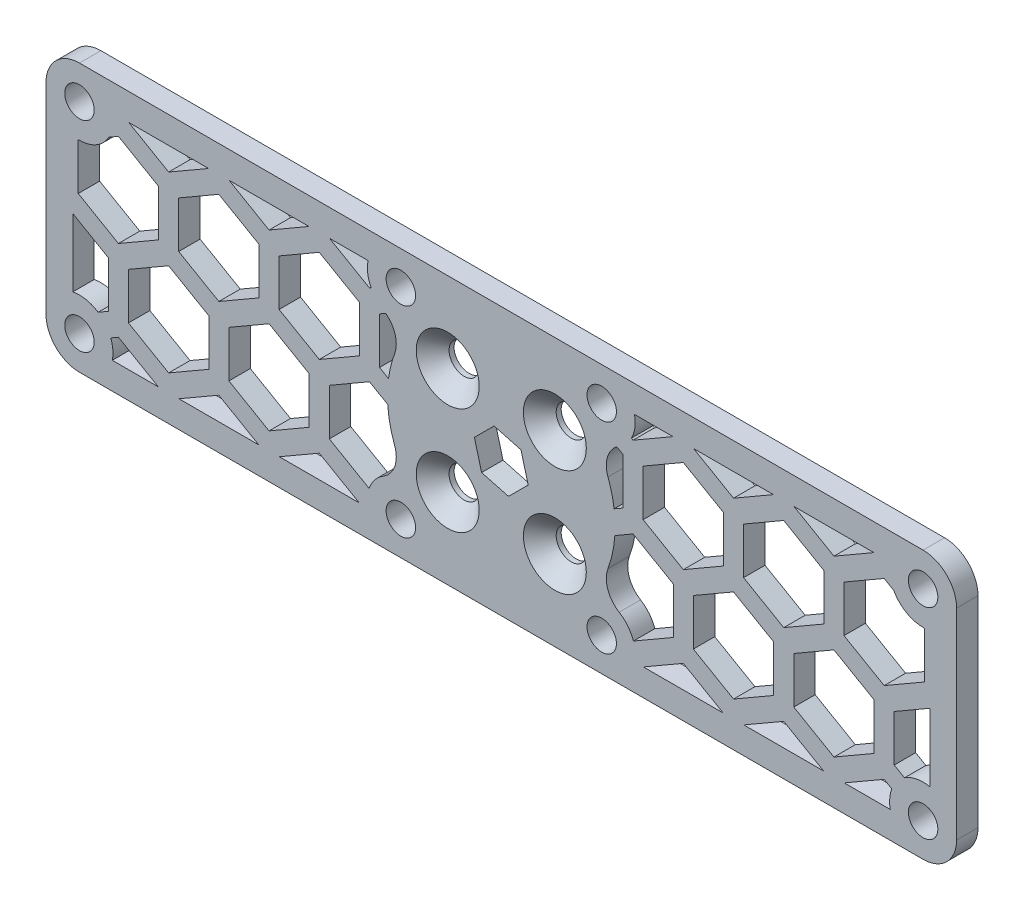
from build123d import *

# Parameters (mm, degrees)
STOCK_BODY_PITCH_GIMBAL_BOX_MASTER_1_START   = -122.57
STOCK_BODY_PITCH_GIMBAL_BOX_MASTER_1_OUT_W   = 136
STOCK_BODY_PITCH_GIMBAL_BOX_MASTER_1_OUT_H   = 40
STOCK_BODY_PITCH_GIMBAL_BOX_MASTER_1_OUT_R   = 2.2
STOCK_BODY_PITCH_GIMBAL_BOX_MASTER_1_DEPTH   = 3.2
CUT_EXTRUDE1_DEPTH                           = 71.952378396
FILLET1_R                                    = 4
BOSS_EXTRUDE1_DEPTH                          = 3.2
CUT_EXTRUDE2_DEPTH                           = 71.952378524
FILL_START                                   = -122.57
FILL_PATTERN1_DEPTH                          = 3.2
FILLET2_R                                    = 5
CSK_FOR_M4_COUNTERSUNK_FLAT_HEAD_SCR_2_COUNT = 2
CSK_FOR_M4_COUNTERSUNK_FLAT_HEAD_SCR_2_PITCH = 16
CSK_FOR_M4_COUNTERSUNK_FLAT_HEAD_SCR_3_COUNT = 2
CSK_FOR_M4_COUNTERSUNK_FLAT_HEAD_SCR_3_PITCH = 22.627416998
CSK_FOR_M4_COUNTERSUNK_FLAT_HEAD_SCR_4_COUNT = 2
CSK_FOR_M4_COUNTERSUNK_FLAT_HEAD_SCR_4_PITCH = 16


# Read off the part's stored shape, not the designer's step: Stock-body_pitch_gimbal_box_master-1, Fill Pattern1
with BuildPart() as part:
    # Stock-body_pitch_gimbal_box_master-1 out → Stock-body_pitch_gimbal_box_master-1 (new body)
    with BuildSketch(Plane.XY.offset(STOCK_BODY_PITCH_GIMBAL_BOX_MASTER_1_START)):
        Rectangle(STOCK_BODY_PITCH_GIMBAL_BOX_MASTER_1_OUT_W, STOCK_BODY_PITCH_GIMBAL_BOX_MASTER_1_OUT_H)
        with Locations((-63, -15)):
            Circle(STOCK_BODY_PITCH_GIMBAL_BOX_MASTER_1_OUT_R, mode=Mode.SUBTRACT)
        with Locations((-15, -15)):
            Circle(STOCK_BODY_PITCH_GIMBAL_BOX_MASTER_1_OUT_R, mode=Mode.SUBTRACT)
        with Locations((-8, -8)):
            Circle(STOCK_BODY_PITCH_GIMBAL_BOX_MASTER_1_OUT_R, mode=Mode.SUBTRACT)
        with Locations((15, -15)):
            Circle(STOCK_BODY_PITCH_GIMBAL_BOX_MASTER_1_OUT_R, mode=Mode.SUBTRACT)
        with Locations((63, -15)):
            Circle(STOCK_BODY_PITCH_GIMBAL_BOX_MASTER_1_OUT_R, mode=Mode.SUBTRACT)
        with Locations((8, -8)):
            Circle(STOCK_BODY_PITCH_GIMBAL_BOX_MASTER_1_OUT_R, mode=Mode.SUBTRACT)
        with Locations((-8, 8)):
            Circle(STOCK_BODY_PITCH_GIMBAL_BOX_MASTER_1_OUT_R, mode=Mode.SUBTRACT)
        with Locations((-63, 15)):
            Circle(STOCK_BODY_PITCH_GIMBAL_BOX_MASTER_1_OUT_R, mode=Mode.SUBTRACT)
        with Locations((-15, 15)):
            Circle(STOCK_BODY_PITCH_GIMBAL_BOX_MASTER_1_OUT_R, mode=Mode.SUBTRACT)
        Polygon((1.075890567, -4.015278258), (-2.939387691, -2.939387691), (-4.015278258, 1.075890567), (-1.075890567, 4.015278258), (2.939387691, 2.939387691), (4.015278258, -1.075890567), align=None, mode=Mode.SUBTRACT)
        with Locations((8, 8)):
            Circle(STOCK_BODY_PITCH_GIMBAL_BOX_MASTER_1_OUT_R, mode=Mode.SUBTRACT)
        with Locations((15, 15)):
            Circle(STOCK_BODY_PITCH_GIMBAL_BOX_MASTER_1_OUT_R, mode=Mode.SUBTRACT)
        with Locations((63, 15)):
            Circle(STOCK_BODY_PITCH_GIMBAL_BOX_MASTER_1_OUT_R, mode=Mode.SUBTRACT)
    extrude(amount=STOCK_BODY_PITCH_GIMBAL_BOX_MASTER_1_DEPTH)

    # Sketch1 → Cut-Extrude1 (cut, through all)
    with BuildSketch(Plane.XY.offset(-119.37)):
        with BuildLine():
            ThreePointArc((-58, 15), (-59.83772234, 11.127016654), (-64, 10.101020514))
            Line((-64, 10.101020514), (-64, -10.101020514))
            ThreePointArc((-64, -10.101020514), (-59.83772234, -11.127016654), (-58, -15))
            ThreePointArc((-58, -15), (-58.025319235, -15.50254481), (-58.101020514, -16))
            Line((-58.101020514, -16), (-19.898979486, -16))
            ThreePointArc((-19.898979486, -16), (-18.386844307, -11.321782274), (-13.6, -10.2))
            ThreePointArc((-13.6, -10.2), (-17, 0), (-13.6, 10.2))
            ThreePointArc((-13.6, 10.2), (-18.386844307, 11.321782274), (-19.898979486, 16))
            Line((-19.898979486, 16), (-58.101020514, 16))
            ThreePointArc((-58.101020514, 16), (-58.025319235, 15.50254481), (-58, 15))
        make_face()
        with BuildLine():
            Line((58.101020514, 16), (19.898979486, 16))
            ThreePointArc((19.898979486, 16), (19.974680765, 15.50254481), (20, 15))
            ThreePointArc((20, 15), (18, 11), (13.6, 10.2))
            ThreePointArc((13.6, 10.2), (16.127616067, 5.375872022), (17, 0))
            ThreePointArc((17, 0), (16.127616067, -5.375872022), (13.6, -10.2))
            ThreePointArc((13.6, -10.2), (18, -11), (20, -15))
            ThreePointArc((20, -15), (19.974680765, -15.50254481), (19.898979486, -16))
            Line((19.898979486, -16), (58.101020514, -16))
            ThreePointArc((58.101020514, -16), (59.464466094, -11.464466094), (64, -10.101020514))
            Line((64, -10.101020514), (64, 10.101020514))
            ThreePointArc((64, 10.101020514), (59.464466094, 11.464466094), (58.101020514, 16))
        make_face()
    extrude(amount=-CUT_EXTRUDE1_DEPTH, mode=Mode.SUBTRACT)

    # Fillet1
    fillet1_edges = [part.edges().sort_by_distance(p)[0] for p in [
        (-13.6, -10.2, -120.97),
        (-13.6, 10.2, -120.97),
        (13.6, -10.2, -120.97),
        (13.6, 10.2, -120.97),
    ]]
    fillet(fillet1_edges, radius=FILLET1_R)


with BuildPart() as body_2:
    # Sketch2 → Boss-Extrude1 (new body)
    with BuildSketch(Plane.XY.offset(-119.37)):
        with BuildLine():
            ThreePointArc((-58.101020514, 16), (-59.464466094, 11.464466094), (-64, 10.101020514))
            Line((-64, 10.101020514), (-64, -10.101020514))
            ThreePointArc((-64, -10.101020514), (-59.464466094, -11.464466094), (-58.101020514, -16))
            Line((-58.101020514, -16), (-19.898979486, -16))
            ThreePointArc((-19.898979486, -16), (-19.583627385, -13.002411456), (-17.602588021, -10.730745312))
            ThreePointArc((-17.602588021, -10.730745312), (-15.905395598, -8.625750803), (-15.935199688, -5.921943169))
            ThreePointArc((-15.935199688, -5.921943169), (-17, 0), (-15.935199688, 5.921943169))
            ThreePointArc((-15.935199688, 5.921943169), (-15.905395598, 8.625750803), (-17.602588021, 10.730745312))
            ThreePointArc((-17.602588021, 10.730745312), (-19.583627385, 13.002411456), (-19.898979486, 16))
            Line((-19.898979486, 16), (-58.101020514, 16))
        make_face()
    extrude(amount=-BOSS_EXTRUDE1_DEPTH)

    # Sketch3 → Cut-Extrude2 (cut, through all)
    with BuildSketch(Plane.XY.offset(-119.37)):
        Polygon((-21.184658438, 9.959292144), (-27.184658438, 13.423393759), (-33.184658438, 9.959292144), (-33.184658438, 3.031088913), (-27.184658438, -0.433012702), (-21.184658438, 3.031088913), align=None)
        Polygon((-13.684658438, -3.031088913), (-19.684658438, 0.433012702), (-25.684658438, -3.031088913), (-25.684658438, -9.959292144), (-19.684658438, -13.423393759), (-13.684658438, -9.959292144), align=None)
    extrude(amount=-CUT_EXTRUDE2_DEPTH, mode=Mode.SUBTRACT)

    # Fill Pattern1 outline → Fill Pattern1 (cut)
    with BuildSketch(Plane.XY.offset(FILL_START)):
        Polygon((-55.684658438, -9.959292144), (-49.684658438, -13.423393759), (-43.684658438, -9.959292144), (-43.684658438, -3.031088913), (-49.684658438, 0.433012702), (-55.684658438, -3.031088913), align=None)
        Polygon((-43.721845517, 16), (-55.64747136, 16), (-49.684658438, 12.557368355), align=None)
        Polygon((-27.184658438, -12.557368355), (-33.14747136, -16), (-21.221845517, -16), align=None)
        Polygon((-42.184658438, -12.557368355), (-48.14747136, -16), (-36.221845517, -16), align=None)
        with BuildLine():
            Line((-57.184658438, -12.557368355), (-58.328436124, -13.21772871))
            ThreePointArc((-58.328436124, -13.21772871), (-58.016619276, -14.592671438), (-58.101020514, -16))
            Line((-58.101020514, -16), (-51.221845517, -16))
            Line((-51.221845517, -16), (-57.184658438, -12.557368355))
        make_face()
        with BuildLine():
            Line((-58.684658438, -3.031088913), (-64, 0.037724968))
            Line((-64, 0.037724968), (-64, -10.101020514))
            ThreePointArc((-64, -10.101020514), (-62.034790063, -10.094047516), (-60.218689568, -10.844965429))
            Line((-60.218689568, -10.844965429), (-58.684658438, -9.959292144))
            Line((-58.684658438, -9.959292144), (-58.684658438, -3.031088913))
        make_face()
        with BuildLine():
            Line((-57.184658438, 13.423393759), (-58.614969913, 12.597603044))
            ThreePointArc((-58.614969913, 12.597603044), (-60.5, 10.669872981), (-63.11197825, 10.00125407))
            Line((-63.11197825, 10.00125407), (-63.184658438, 9.959292144))
            Line((-63.184658438, 9.959292144), (-63.184658438, 3.031088913))
            Line((-63.184658438, 3.031088913), (-57.184658438, -0.433012702))
            Line((-57.184658438, -0.433012702), (-51.184658438, 3.031088913))
            Line((-51.184658438, 3.031088913), (-51.184658438, 9.959292144))
            Line((-51.184658438, 9.959292144), (-57.184658438, 13.423393759))
        make_face()
        with BuildLine():
            ThreePointArc((-15.935199688, 5.921943169), (-15.842056464, 8.426381643), (-17.257347713, 10.494675241))
            Line((-17.257347713, 10.494675241), (-18.184658438, 9.959292144))
            Line((-18.184658438, 9.959292144), (-18.184658438, 3.031088913))
            Line((-18.184658438, 3.031088913), (-16.849105828, 2.260007254))
            ThreePointArc((-16.849105828, 2.260007254), (-16.494093358, 4.116416438), (-15.935199688, 5.921943169))
        make_face()
        with BuildLine():
            Line((-19.898979486, 16), (-25.64747136, 16))
            Line((-25.64747136, 16), (-19.684658438, 12.557368355))
            Line((-19.684658438, 12.557368355), (-19.439138295, 12.699119475))
            ThreePointArc((-19.439138295, 12.699119475), (-19.952177701, 14.31011884), (-19.898979486, 16))
        make_face()
        Polygon((-28.721845517, 16), (-40.64747136, 16), (-34.684658438, 12.557368355), align=None)
        Polygon((-48.184658438, 9.959292144), (-48.184658438, 3.031088913), (-42.184658438, -0.433012702), (-36.184658438, 3.031088913), (-36.184658438, 9.959292144), (-42.184658438, 13.423393759), align=None)
        Polygon((-34.684658438, -13.423393759), (-28.684658438, -9.959292144), (-28.684658438, -3.031088913), (-34.684658438, 0.433012702), (-40.684658438, -3.031088913), (-40.684658438, -9.959292144), align=None)
    extrude(amount=FILL_PATTERN1_DEPTH, mode=Mode.SUBTRACT)


with BuildPart() as body_3:
    # Mirror2: mirrored copy
    add(body_2.part.mirror(Plane(origin=(0, 0, 0), x_dir=(0, 0, 1), z_dir=(1, 0, 0))))


with BuildPart() as part_1:
    add(part.part)

    # Combine1: union body 2, body 3
    add(body_2.part)
    add(body_3.part)

    # Fillet2
    fillet2_edges = [part_1.edges().sort_by_distance(p)[0] for p in [
        (-68, -20, -120.97),
        (68, -20, -120.97),
        (68, 20, -120.97),
        (-68, 20, -120.97),
    ]]
    fillet(fillet2_edges, radius=FILLET2_R)

    # Sketch8 → CSK for M4 Countersunk Flat Head Screw1 (revolve, cut)
    with BuildSketch(Plane(origin=(8, 8, -119.37), x_dir=(0, -1, 0), z_dir=(1, 0, 0))):
        Polygon((0, 0), (0, 3.2), (2.25, 3.2), (2.25, 2.45), (4.7, 0), align=None)
    csk_for_m4_countersunk_flat_head_screw1 = revolve(axis=Axis((8, 8, -113.02), (0, 0, -1)), mode=Mode.SUBTRACT)

    # CSK for M4 Countersunk Flat Head Scr 2: CSK for M4 Countersunk Flat Head Screw1 ×2
    with Locations(*[(0, -i * CSK_FOR_M4_COUNTERSUNK_FLAT_HEAD_SCR_2_PITCH, 0) for i in range(1, CSK_FOR_M4_COUNTERSUNK_FLAT_HEAD_SCR_2_COUNT)]):
        add(csk_for_m4_countersunk_flat_head_screw1, mode=Mode.SUBTRACT)

    # CSK for M4 Countersunk Flat Head Scr 3: CSK for M4 Countersunk Flat Head Screw1 ×2
    with Locations(*[Vector(-0.7071067811865476, -0.7071067811865476, 0) * (i * CSK_FOR_M4_COUNTERSUNK_FLAT_HEAD_SCR_3_PITCH) for i in range(1, CSK_FOR_M4_COUNTERSUNK_FLAT_HEAD_SCR_3_COUNT)]):
        add(csk_for_m4_countersunk_flat_head_screw1, mode=Mode.SUBTRACT)

    # CSK for M4 Countersunk Flat Head Scr 4: CSK for M4 Countersunk Flat Head Screw1 ×2
    with Locations(*[(-i * CSK_FOR_M4_COUNTERSUNK_FLAT_HEAD_SCR_4_PITCH, 0, 0) for i in range(1, CSK_FOR_M4_COUNTERSUNK_FLAT_HEAD_SCR_4_COUNT)]):
        add(csk_for_m4_countersunk_flat_head_screw1, mode=Mode.SUBTRACT)


solid = part_1.part
